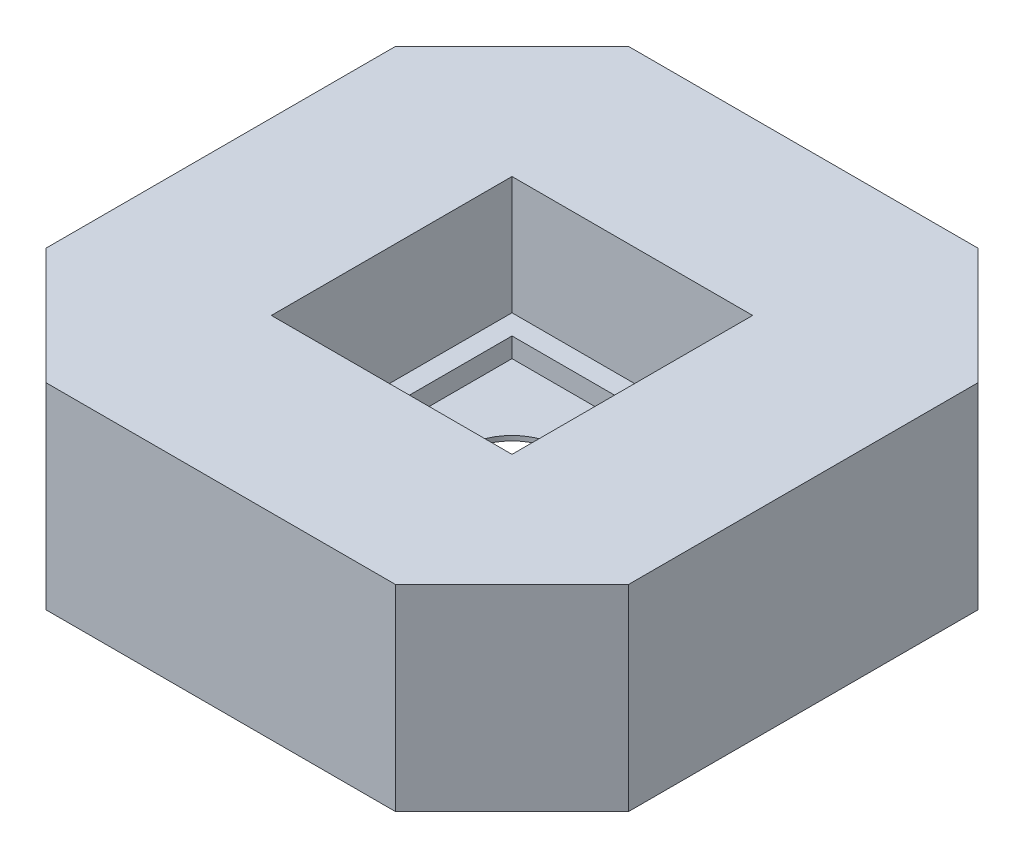
from build123d import *

# Parameters (mm, degrees)
EXTRUDE_1_DEPTH                    = 206
SKETCH_3_W                         = 252
SKETCH_3_H                         = 252
CUT_EXTRUDE_1_DEPTH                = 123.6
SKETCH_5_W                         = 210
SKETCH_5_H                         = 210
CUT_EXTRUDE_5_DEPTH                = 20.6
SHELL_9_T                          = -5
SKETCH_6_R                         = 50
CUT_EXTRUDE_6_DEPTH                = 455.80065963
RIB_1_REACH                        = 542.993
SKETCH_7_WALL_W                    = 1255.59277199
SKETCH_7_WALL_H                    = 10
PATTERN_CIRCULAR_1_COUNT           = 4
PATTERN_CIRCULAR_1_COPY_1_REACH    = 542.993
PATTERN_CIRCULAR_1_COPY_1_SKETCH_W = 1255.59277199
PATTERN_CIRCULAR_1_COPY_1_SKETCH_H = 10
PATTERN_CIRCULAR_1_COPY_2_REACH    = 542.993
PATTERN_CIRCULAR_1_COPY_2_SKETCH_W = 1255.59277199
PATTERN_CIRCULAR_1_COPY_2_SKETCH_H = 10
PATTERN_CIRCULAR_1_COPY_3_REACH    = 542.993
PATTERN_CIRCULAR_1_COPY_3_SKETCH_W = 1255.59277199
PATTERN_CIRCULAR_1_COPY_3_SKETCH_H = 10


with BuildPart() as part:
    # 草图1 → 凸台-拉伸1 (new body)
    with BuildSketch(Plane(origin=(0, 0, 0), x_dir=(1, 0, 0), z_dir=(0, 1, 0))):
        Polygon((-305, 183), (-183, 305), (183, 305), (305, 183), (305, -183), (183, -305), (-183, -305), (-305, -183), align=None)
    extrude(amount=EXTRUDE_1_DEPTH)

    # 草图3 → 切除-拉伸1 (cut)
    with BuildSketch(Plane(origin=(0, 206, 0), x_dir=(1, 0, 0), z_dir=(0, 1, 0))):
        Rectangle(SKETCH_3_W, SKETCH_3_H)
    extrude(amount=-CUT_EXTRUDE_1_DEPTH, mode=Mode.SUBTRACT)

    # 草图5 → 切除-拉伸5 (cut)
    with BuildSketch(Plane(origin=(0, 82.4, 0), x_dir=(1, 0, 0), z_dir=(0, 1, 0))):
        Rectangle(SKETCH_5_W, SKETCH_5_H)
    extrude(amount=-CUT_EXTRUDE_5_DEPTH, mode=Mode.SUBTRACT)

    # 抽壳9
    shell_9_openings = [part.faces().sort_by_distance(p)[0] for p in [
        (0, 0, 0),
    ]]
    offset(amount=SHELL_9_T, openings=shell_9_openings, kind=Kind.INTERSECTION)

    # 草图6 → 切除-拉伸6 (cut, through all)
    with BuildSketch(Plane(origin=(0, 61.8, 0), x_dir=(1, 0, 0), z_dir=(0, 1, 0))):
        Circle(SKETCH_6_R)
    extrude(amount=-CUT_EXTRUDE_6_DEPTH, mode=Mode.SUBTRACT)

    # 草图7 wall → 筋1 (add, up to next)
    with BuildSketch(Plane(origin=(-215.5, 97.29962987, 91.5), x_dir=(-0.984807753012, 0.173648177668, 0), z_dir=(-0.173648177668, -0.984807753012, 0)), mode=Mode.PRIVATE) as rib_1_sk1:
        Rectangle(SKETCH_7_WALL_W, SKETCH_7_WALL_H)
    rib_1_tool1 = extrude(rib_1_sk1.sketch, amount=-RIB_1_REACH, mode=Mode.PRIVATE) - part.part
    rib_1 = rib_1_tool1.solids().sort_by_distance((-215.5, 97.29962987, 91.5))[0]
    add(rib_1)

    # 镜向1: 筋1 across plane
    add(rib_1.mirror(Plane.XY))

    # 阵列(圆周)1: 筋1 ×4 about axis
    pattern_circular_1_axis = Axis((0, 56.8, 0), (0, -1, 0))
    for i in range(1, PATTERN_CIRCULAR_1_COUNT):
        add(rib_1.rotate(pattern_circular_1_axis, i * 360 / PATTERN_CIRCULAR_1_COUNT))

    # 阵列(圆周)1 copy 1 sketch → 阵列(圆周)1 copy 1 (add, up to next)
    with BuildSketch(Plane(origin=(91.5, 97.29962987, -215.5), x_dir=(0, 0.173648177668, -0.984807753012), z_dir=(0, -0.984807753012, -0.173648177668)), mode=Mode.PRIVATE) as pattern_circular_1_copy_1_sk1:
        Rectangle(PATTERN_CIRCULAR_1_COPY_1_SKETCH_W, PATTERN_CIRCULAR_1_COPY_1_SKETCH_H)
    pattern_circular_1_copy_1_tool1 = extrude(pattern_circular_1_copy_1_sk1.sketch, amount=-PATTERN_CIRCULAR_1_COPY_1_REACH, mode=Mode.PRIVATE) - part.part
    add(pattern_circular_1_copy_1_tool1.solids().sort_by_distance((91.5, 97.29962987, -215.5))[0])

    # 阵列(圆周)1 copy 2 sketch → 阵列(圆周)1 copy 2 (add, up to next)
    with BuildSketch(Plane(origin=(215.5, 97.29962987, 91.5), x_dir=(0.984807753012, 0.173648177668, 0), z_dir=(0.173648177668, -0.984807753012, 0)), mode=Mode.PRIVATE) as pattern_circular_1_copy_2_sk1:
        Rectangle(PATTERN_CIRCULAR_1_COPY_2_SKETCH_W, PATTERN_CIRCULAR_1_COPY_2_SKETCH_H)
    pattern_circular_1_copy_2_tool1 = extrude(pattern_circular_1_copy_2_sk1.sketch, amount=-PATTERN_CIRCULAR_1_COPY_2_REACH, mode=Mode.PRIVATE) - part.part
    add(pattern_circular_1_copy_2_tool1.solids().sort_by_distance((215.5, 97.29962987, 91.5))[0])

    # 阵列(圆周)1 copy 3 sketch → 阵列(圆周)1 copy 3 (add, up to next)
    with BuildSketch(Plane(origin=(-91.5, 97.29962987, 215.5), x_dir=(0, 0.173648177668, 0.984807753012), z_dir=(0, -0.984807753012, 0.173648177668)), mode=Mode.PRIVATE) as pattern_circular_1_copy_3_sk1:
        Rectangle(PATTERN_CIRCULAR_1_COPY_3_SKETCH_W, PATTERN_CIRCULAR_1_COPY_3_SKETCH_H)
    pattern_circular_1_copy_3_tool1 = extrude(pattern_circular_1_copy_3_sk1.sketch, amount=-PATTERN_CIRCULAR_1_COPY_3_REACH, mode=Mode.PRIVATE) - part.part
    add(pattern_circular_1_copy_3_tool1.solids().sort_by_distance((-91.5, 97.29962987, 215.5))[0])


solid = part.part
